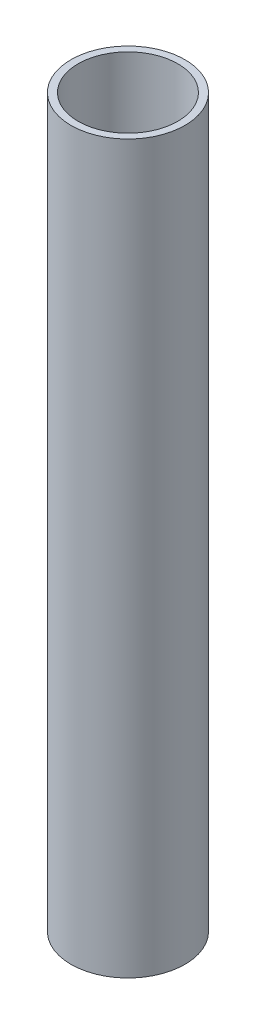
from build123d import *

# Parameters (mm, degrees)
SKETCH1_R           = 25.4
SKETCH1_R_2         = 22.225
BOSS_EXTRUDE1_DEPTH = 323.85


with BuildPart() as part:
    # Sketch1 → Boss-Extrude1 (new body)
    with BuildSketch(Plane(origin=(0, 0, 0), x_dir=(1, 0, 0), z_dir=(0, 1, 0))):
        Circle(SKETCH1_R)
        Circle(SKETCH1_R_2, mode=Mode.SUBTRACT)
    extrude(amount=BOSS_EXTRUDE1_DEPTH)


solid = part.part
